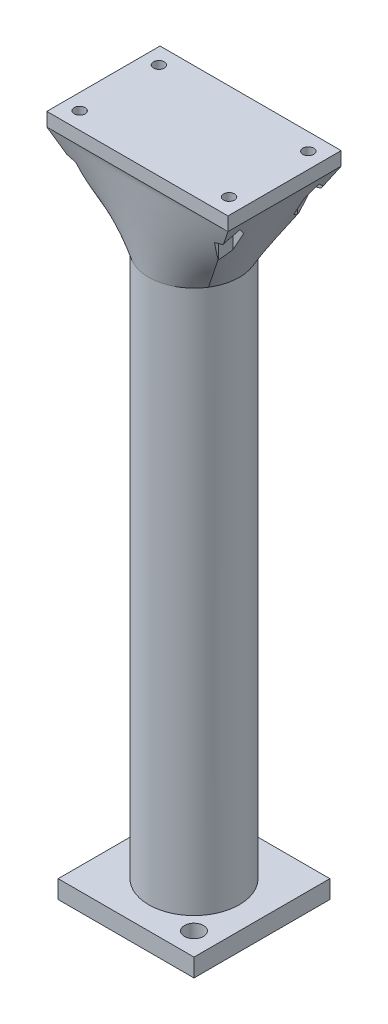
from build123d import *

# Parameters (mm, degrees)
SKETCH1_W           = 30
SKETCH1_H           = 30
BOSS_EXTRUDE1_DEPTH = 4
SKETCH2_R           = 2.1
CUT_EXTRUDE1_DEPTH  = 22.587033145
SKETCH3_R           = 10
BOSS_EXTRUDE2_DEPTH = 120
SKETCH4_2_W         = 40
SKETCH4_2_H         = 25
BOSS_EXTRUDE3_DEPTH = 3
SKETCH7_R           = 1.2
CUT_EXTRUDE2_DEPTH  = 30
CUT_EXTRUDE3_DEPTH  = 30


with BuildPart() as part:
    # Sketch1 → Boss-Extrude1 (new body)
    with BuildSketch(Plane(origin=(0, 0, 0), x_dir=(1, 0, 0), z_dir=(0, 1, 0))):
        Rectangle(SKETCH1_W, SKETCH1_H)
    extrude(amount=BOSS_EXTRUDE1_DEPTH)

    # Sketch2 → Cut-Extrude1 (cut, through all)
    with BuildSketch(Plane(origin=(0, 4, 0), x_dir=(1, 0, 0), z_dir=(0, 1, 0))):
        with Locations((-10, 10)):
            Circle(SKETCH2_R)
        with Locations((10, -10)):
            Circle(SKETCH2_R)
    extrude(amount=-CUT_EXTRUDE1_DEPTH, mode=Mode.SUBTRACT)

    # Sketch3 → Boss-Extrude2 (add)
    with BuildSketch(Plane(origin=(0, 4, 0), x_dir=(1, 0, 0), z_dir=(0, 1, 0))):
        Circle(SKETCH3_R)
    extrude(amount=BOSS_EXTRUDE2_DEPTH)

    # Sketch5 for Loft1 → Loft1 section 0
    with BuildSketch(Plane(origin=(0, 124, 0), x_dir=(1, 0, 0), z_dir=(0, 1, 0))):
        with BuildLine():
            # circular arc as an exact rational Bezier (weights 1, cos(half-angle), 1)
            Bezier((-8.47998304, -5.2999894), (0, -18.867962264), (8.47998304, -5.2999894), weights=[1, 0.52999894, 1])
            Bezier((8.47998304, -5.2999894), (11.792476415, 0), (8.47998304, 5.2999894), weights=[1, 0.847998304, 1])
            Bezier((8.47998304, 5.2999894), (0, 18.867962264), (-8.47998304, 5.2999894), weights=[1, 0.52999894, 1])
            Bezier((-8.47998304, 5.2999894), (-11.792476415, 0), (-8.47998304, -5.2999894), weights=[1, 0.847998304, 1])
        make_face()
    # Sketch4 → Loft1 section 1
    with BuildSketch(Plane(origin=(0, 144, 0), x_dir=(1, 0, 0), z_dir=(0, 1, 0))):
        with BuildLine():
            Line((-20, -12.5), (20, -12.5))
            Line((20, -12.5), (20, 12.5))
            Line((20, 12.5), (-20, 12.5))
            Line((-20, 12.5), (-20, -12.5))
        make_face()
    loft()

    # Sketch4<2> → Boss-Extrude3 (add)
    with BuildSketch(Plane(origin=(0, 144, 0), x_dir=(1, 0, 0), z_dir=(0, 1, 0))):
        Rectangle(SKETCH4_2_W, SKETCH4_2_H)
    extrude(amount=BOSS_EXTRUDE3_DEPTH)

    # Sketch7 → Cut-Extrude2 (cut)
    with BuildSketch(Plane(origin=(0, 147, 0), x_dir=(1, 0, 0), z_dir=(0, 1, 0))):
        with Locations((-16.5, 8.75)):
            Circle(SKETCH7_R)
        with Locations((-16.5, -8.75)):
            Circle(SKETCH7_R)
        with Locations((16.5, 8.75)):
            Circle(SKETCH7_R)
        with Locations((16.5, -8.75)):
            Circle(SKETCH7_R)
    extrude(amount=-CUT_EXTRUDE2_DEPTH, mode=Mode.SUBTRACT)

    # Sketch8 → Cut-Extrude3 (cut)
    with BuildSketch(Plane(origin=(0, 144, 0), x_dir=(1, 0, 0), z_dir=(0, 1, 0))):
        Polygon((-17.683568052, 6.7), (-15.316431948, 6.7), (-14.132863896, 8.75), (-15.316431948, 10.8), (-17.683568052, 10.8), (-18.867136104, 8.75), align=None)
        Polygon((-15.316431948, -6.7), (-17.683568052, -6.7), (-18.867136104, -8.75), (-17.683568052, -10.8), (-15.316431948, -10.8), (-14.132863896, -8.75), align=None)
        Polygon((15.316431948, 6.7), (17.683568052, 6.7), (18.867136104, 8.75), (17.683568052, 10.8), (15.316431948, 10.8), (14.132863896, 8.75), align=None)
        Polygon((14.132863896, -8.75), (15.316431948, -10.8), (17.683568052, -10.8), (18.867136104, -8.75), (17.683568052, -6.7), (15.316431948, -6.7), align=None)
    extrude(amount=-CUT_EXTRUDE3_DEPTH, mode=Mode.SUBTRACT)


solid = part.part
